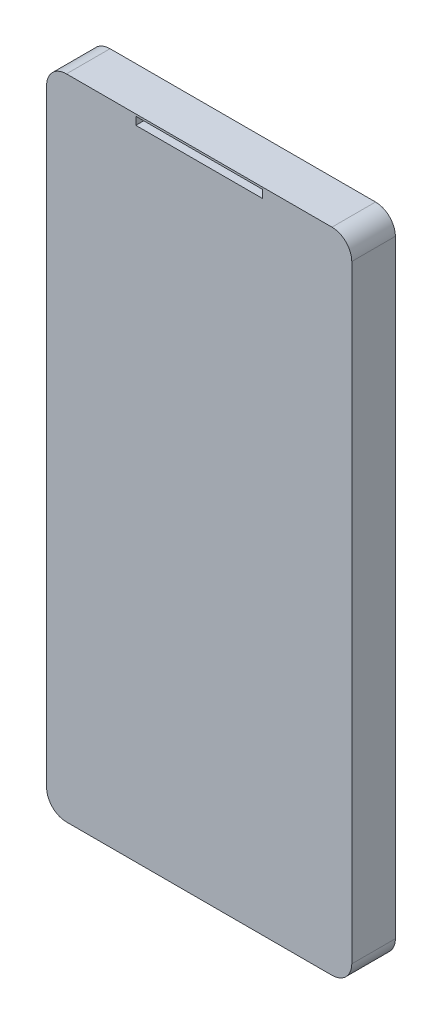
from build123d import *

# Parameters (mm, degrees)
SKETCH_1_W          = 77
SKETCH_1_H          = 163.5
EXTRUDE_1_DEPTH     = 11
SKETCH_2_W          = 33
SKETCH_2_H          = 64.3
EXTRUDE_2_DEPTH     = 2.1
FILLET_1_R          = 5
FILLET_2_R          = 5
SKETCH_3_W          = 32
SKETCH_3_H          = 2
CUT_EXTRUDE_1_DEPTH = 2
WRAP_1_OUTLINE_R    = 1
WRAP_1_DEPTH        = 0.01


# Read off the part's stored shape, not the designer's step: 包覆1
with BuildPart() as part:
    # 草图1 → 凸台-拉伸1 (new body)
    with BuildSketch(Plane.XY):
        Rectangle(SKETCH_1_W, SKETCH_1_H)
    extrude(amount=EXTRUDE_1_DEPTH)

    # 草图2 → 凸台-拉伸2 (add)
    with BuildSketch(Plane(origin=(0, 0, 0), x_dir=(-1, 0, 0), z_dir=(0, 0, -1))):
        with Locations((-15, 46.6)):
            Rectangle(SKETCH_2_W, SKETCH_2_H)
    extrude(amount=EXTRUDE_2_DEPTH)

    # 圆角1
    fillet_1_edges = [part.edges().sort_by_distance(p)[0] for p in [
        (31.5, 78.75, -1.05),
        (31.5, 14.45, -1.05),
        (-1.5, 14.45, -1.05),
        (-1.5, 78.75, -1.05),
    ]]
    fillet(fillet_1_edges, radius=FILLET_1_R)

    # 圆角2
    fillet_2_edges = [part.edges().sort_by_distance(p)[0] for p in [
        (38.5, -81.75, 5.5),
        (-38.5, -81.75, 5.5),
        (-38.5, 81.75, 5.5),
        (38.5, 81.75, 5.5),
    ]]
    fillet(fillet_2_edges, radius=FILLET_2_R)

    # 草图3 → 切除-拉伸1 (cut)
    with BuildSketch(Plane.XY.offset(11)):
        with Locations((0, 80.25)):
            Rectangle(SKETCH_3_W, SKETCH_3_H)
    extrude(amount=-CUT_EXTRUDE_1_DEPTH, mode=Mode.SUBTRACT)

    # 包覆1 outline → 包覆1 (add)
    with BuildSketch(Plane(origin=(0, 0, 0), x_dir=(-1, 0, 0), z_dir=(0, 0, -1))):
        Circle(WRAP_1_OUTLINE_R)
    extrude(amount=WRAP_1_DEPTH)


solid = part.part
